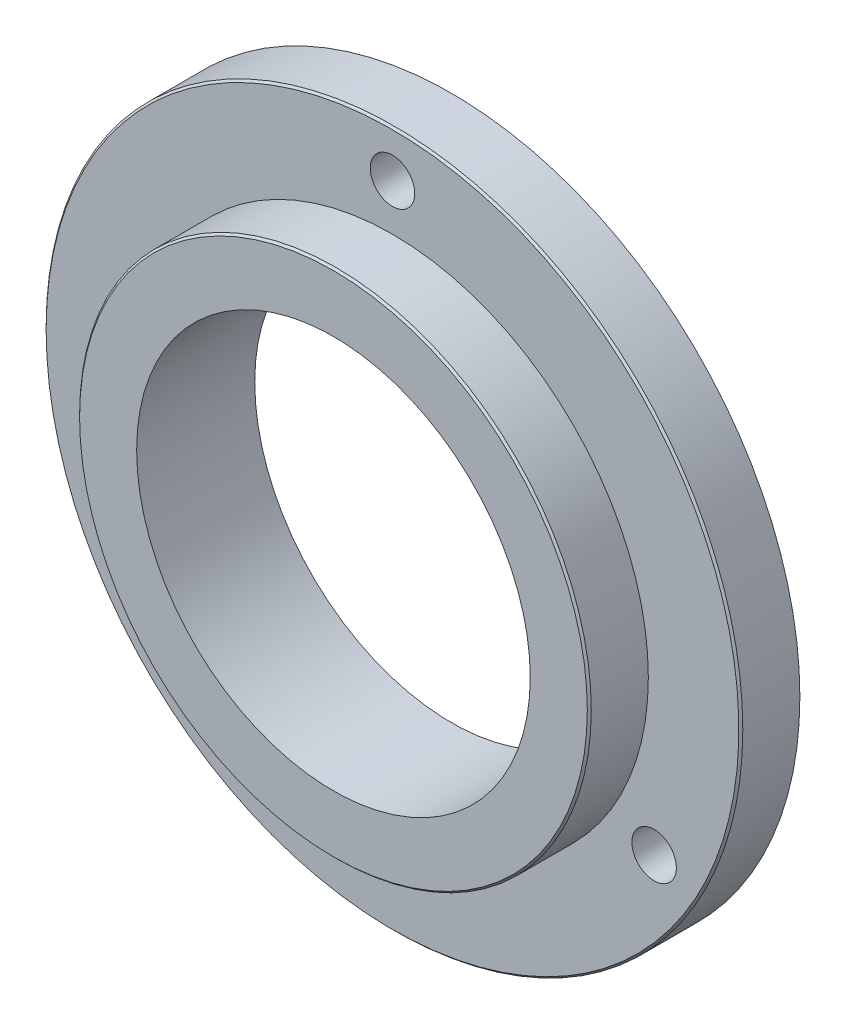
from build123d import *
from build123d.topology import SkipClean

# Parameters (mm, degrees)
ESQUISSE10_R          = 13
ESQUISSE10_R_2        = 10
BOSS_EXTRU_2_DEPTH    = 3
BOSS_EXTRU_3_START    = 3
ESQUISSE11_R          = 17.7
ESQUISSE11_R_2        = 10
BOSS_EXTRU_3_DEPTH    = 3
F_4_40_TAPPED_HOLE1_D = 2.2606
CIRPATTERN1_COUNT     = 3
CHAMFER1_SIZE         = 0.1
CHAMFER2_SIZE         = 0.1


with BuildPart() as part:
    # Esquisse10 → Boss.-Extru.2 (new body)
    with BuildSketch(Plane.XY):
        Circle(ESQUISSE10_R)
        Circle(ESQUISSE10_R_2, mode=Mode.SUBTRACT)
    extrude(amount=BOSS_EXTRU_2_DEPTH)

    # Esquisse11 → Boss.-Extru.3 (add)
    with SkipClean():  # the faces are left unmerged after this step: merging them gives an invalid solid
        with BuildSketch(Plane(origin=(0, 0, 0), x_dir=(-1, 0, 0), z_dir=(0, 0, -1)).offset(BOSS_EXTRU_3_START)):
            Circle(ESQUISSE11_R)
            Circle(ESQUISSE11_R_2, mode=Mode.SUBTRACT)
        extrude(amount=-BOSS_EXTRU_3_DEPTH)

    # #4-40 Tapped Hole1 (through all)
    with Locations(Plane.XY):
        with Locations((0, 15.35)):
            f_4_40_tapped_hole1 = Hole(F_4_40_TAPPED_HOLE1_D / 2)

    # CirPattern1: #4-40 Tapped Hole1 ×3 about axis
    with SkipClean():  # the faces are left unmerged after this step: merging them gives an invalid solid
        cirpattern1_axis = Axis((0, 0, 3), (0, 0, -1))
        for i in range(1, CIRPATTERN1_COUNT):
            add(f_4_40_tapped_hole1.rotate(cirpattern1_axis, i * 360 / CIRPATTERN1_COUNT), mode=Mode.SUBTRACT)

    # Chamfer1
    chamfer1_edges = [part.edges().sort_by_distance(p)[0] for p in [
        (17.7, 0, 0),
    ]]
    chamfer(chamfer1_edges, length=CHAMFER1_SIZE)

    # Chamfer2
    chamfer2_edges = [part.edges().sort_by_distance(p)[0] for p in [
        (-13, 0, 3),
    ]]
    chamfer(chamfer2_edges, length=CHAMFER2_SIZE)


solid = part.part
